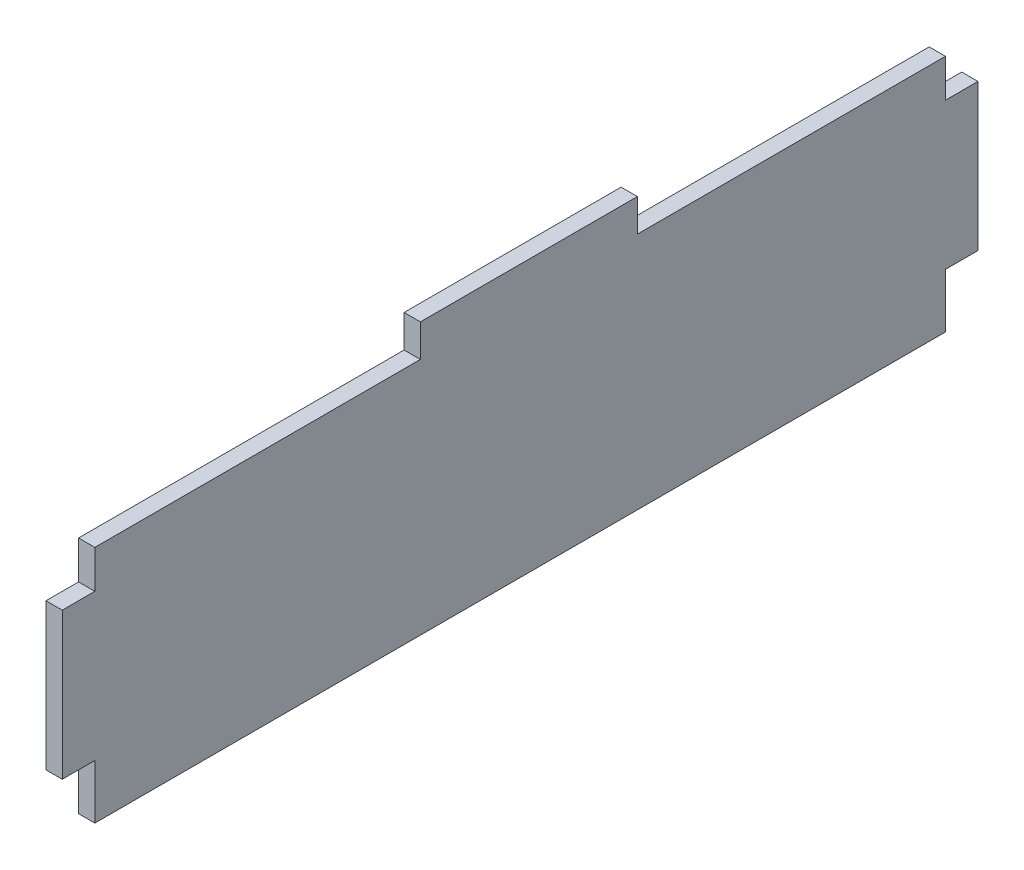
from build123d import *

# Parameters (mm, degrees)
BOSS_EXTRUDE1_DEPTH = 3


with BuildPart() as part:
    # Sketch2 → Boss-Extrude1 (new body)
    with BuildSketch(Plane(origin=(0, 0, 0), x_dir=(0, 0, -1), z_dir=(1, 0, 0))):
        Polygon((63, 3.015400021), (103, 3.015400021), (103, -2.984599979), (159.781661072, -2.984599979), (159.781661072, -10), (165.781661072, -10), (165.781661072, -37), (159.781661072, -37), (159.781661072, -47), (3, -47), (3, -37), (-3, -37), (-3, -10), (3, -10), (3, -2.984599979), (63, -2.984599979), align=None)
    extrude(amount=BOSS_EXTRUDE1_DEPTH)


solid = part.part
